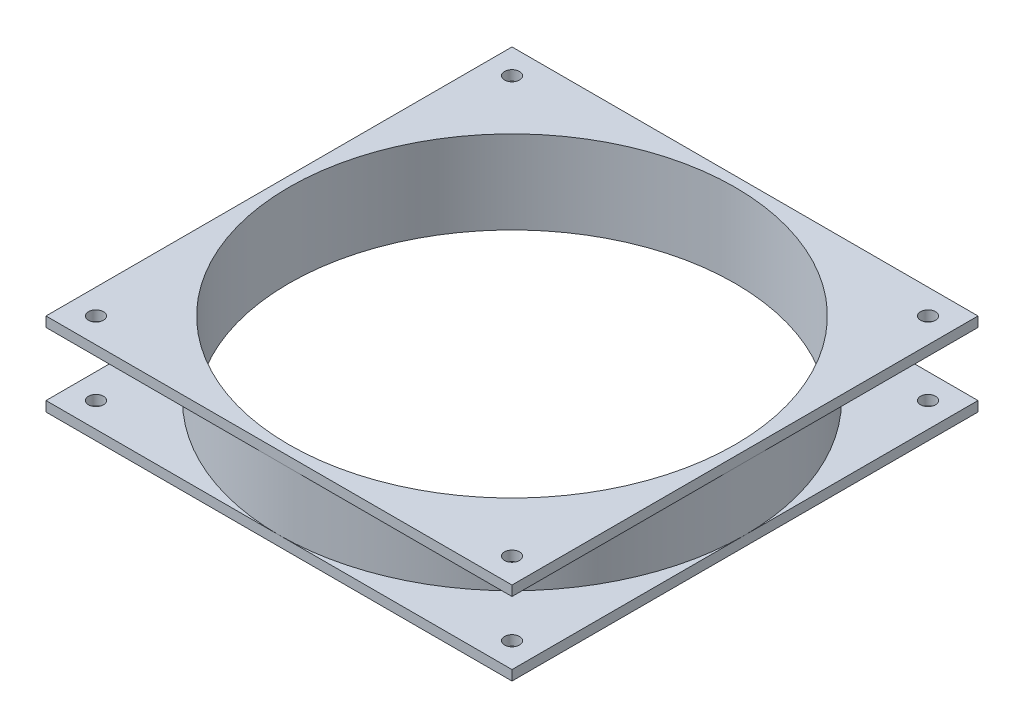
from build123d import *

# Parameters (mm, degrees)
SKETCH2_OUTSIDE_W            = 258.79
SKETCH2_OUTSIDE_H            = 258.79
SKETCH2_OUTSIDE_W_2          = 140
SKETCH2_OUTSIDE_H_2          = 140
SQUARE_SHAPE_CUTOUT_DEPTH    = 144.614066163
M4_CLEARANCE_HOLE1_OUTLINE_R = 2.25
M4_CLEARANCE_HOLE1_DEPTH     = 25


# Read off the part's stored shape, not the designer's step: M4 Clearance Hole1
with BuildPart() as part:
    # Sketch1 → body (revolve)
    with BuildSketch(Plane.XY, mode=Mode.PRIVATE) as body_sk:
        Polygon((67, 0), (100, 0), (100, 3), (70, 3), (70, 22), (100, 22), (100, 25), (67, 25), align=None)
    revolve(body_sk.sketch.rotate(Axis((0, 0, 0), (0, 1, 0)), 90), axis=Axis((0, 0, 0), (0, 1, 0)))

    # Sketch2 outside → square_shape_cutout (cut, through all)
    with BuildSketch(Plane(origin=(0, 25, 0), x_dir=(1, 0, 0), z_dir=(0, 1, 0))):
        Rectangle(SKETCH2_OUTSIDE_W, SKETCH2_OUTSIDE_H)
        Rectangle(SKETCH2_OUTSIDE_W_2, SKETCH2_OUTSIDE_H_2, mode=Mode.SUBTRACT)
    extrude(amount=-SQUARE_SHAPE_CUTOUT_DEPTH, mode=Mode.SUBTRACT)

    # M4 Clearance Hole1 outline → M4 Clearance Hole1 (cut)
    with BuildSketch(Plane(origin=(0, 0, 0), x_dir=(1, 0, 0), z_dir=(0, 1, 0))):
        with Locations((62.5, 62.5)):
            Circle(M4_CLEARANCE_HOLE1_OUTLINE_R)
        with Locations((-62.5, -62.5)):
            Circle(M4_CLEARANCE_HOLE1_OUTLINE_R)
        with Locations((62.5, -62.5)):
            Circle(M4_CLEARANCE_HOLE1_OUTLINE_R)
        with Locations((-62.5, 62.5)):
            Circle(M4_CLEARANCE_HOLE1_OUTLINE_R)
    extrude(amount=M4_CLEARANCE_HOLE1_DEPTH, mode=Mode.SUBTRACT)


solid = part.part
